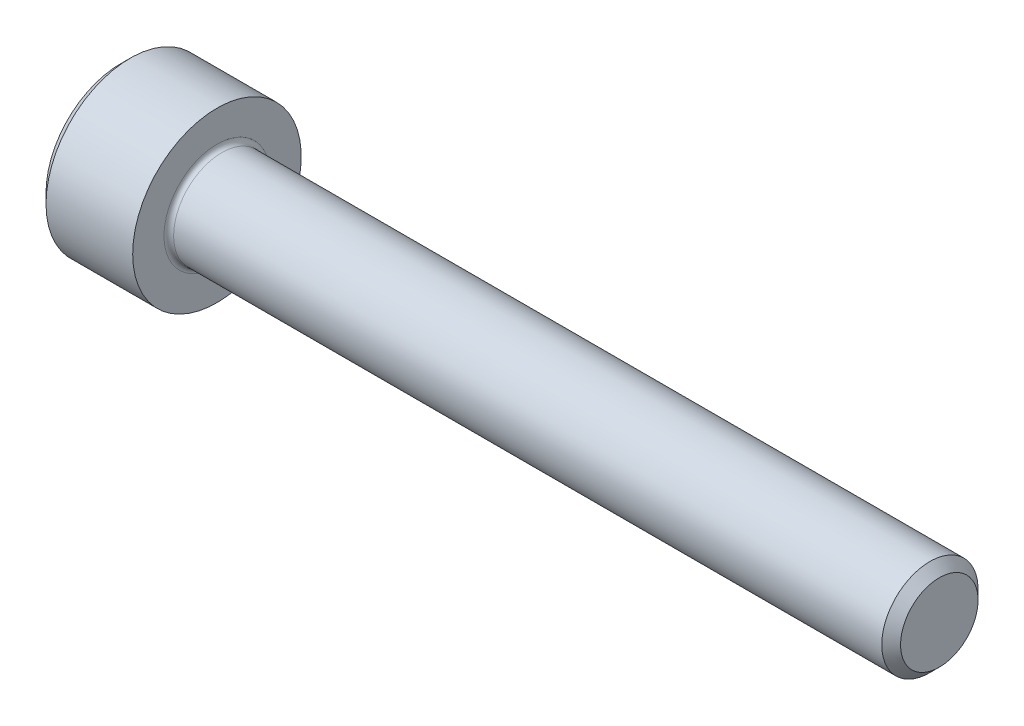
from build123d import *

# Parameters (mm, degrees)
FILLET1_R   = 0.2
HEX_2_DEPTH = 2


with BuildPart() as part:
    # BodySke → Base-Revolve (revolve)
    with BuildSketch(Plane.XY):
        Polygon((0, 0), (0, 3.1), (0.4, 3.5), (4, 3.5), (4, 2), (33.61, 2), (34, 1.61), (34, 0), align=None)
    revolve(axis=Axis((-31.75, 0, 0), (1, 0, 0)))

    # Fillet1
    fillet1_edges = [part.edges().sort_by_distance(p)[0] for p in [
        (4, -2, 0),
    ]]
    fillet(fillet1_edges, radius=FILLET1_R)

    # Sketch2 → Hex-PreBroach (revolve, cut)
    with BuildSketch(Plane.XY):
        Polygon((0, 1.5355), (2, 1.5355), (2.886521338, 0), (0, 0), align=None)
    revolve(axis=Axis((0, 0, 0), (1, 0, 0)), mode=Mode.SUBTRACT)

    # Sketch3 → Hex 2 (cut)
    with BuildSketch(Plane(origin=(0, 0, 0), x_dir=(0, 0.500000000000001, 0.866025403784438), z_dir=(-1, 0, 0))):
        Polygon((0.886521338, 1.5355), (-0.886521338, 1.5355), (-1.773042677, 0), (-0.886521338, -1.5355), (0.886521338, -1.5355), (1.773042677, 0), align=None)
    extrude(amount=-HEX_2_DEPTH, mode=Mode.SUBTRACT)


solid = part.part
